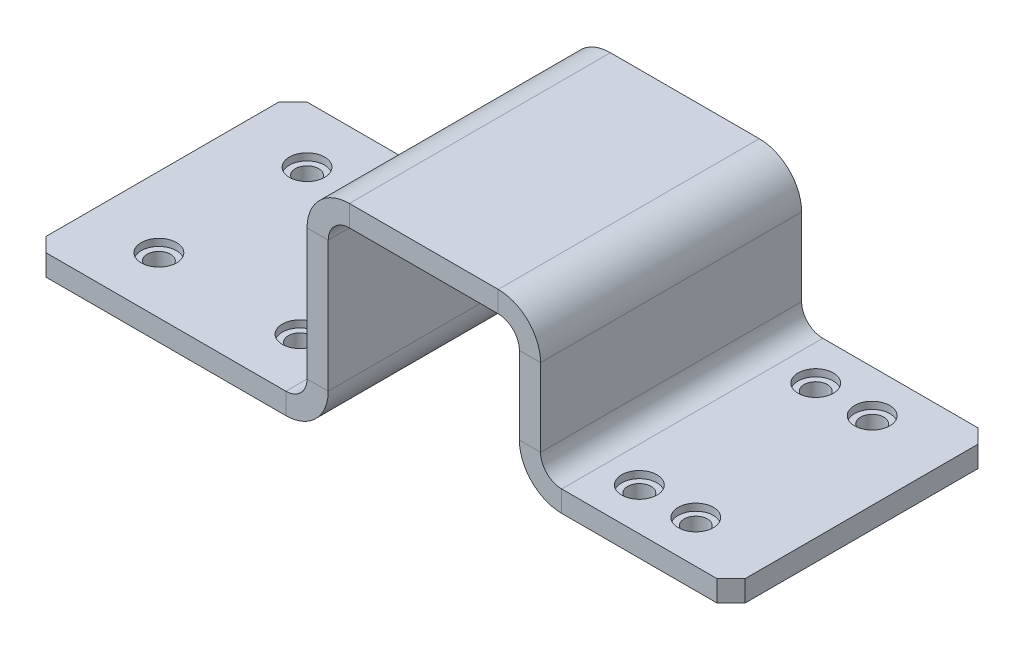
from build123d import *

# Parameters (mm, degrees)
SM_BASE_FLANGE_1_DEPTH    = 37
CHAMFER_1_SIZE            = 2
HOLE_WIZARD_1_D           = 3.3
HOLE_WIZARD_1_DEPTH       = 3
HOLE_WIZARD_1_CBORE_D     = 5
HOLE_WIZARD_1_CBORE_DEPTH = 1
HOLE_WIZARD_1_TIP         = 0.991420021
HOLE_WIZARD_2_D           = 3.3
HOLE_WIZARD_2_DEPTH       = 3
HOLE_WIZARD_2_CBORE_D     = 5
HOLE_WIZARD_2_CBORE_DEPTH = 1
HOLE_WIZARD_2_TIP         = 0.991420021


# Sheet-metal steps are written as plain solids
with BuildPart() as part:
    # Sketch 1 → 基体-法兰1 (new body)
    with BuildSketch(Plane.XY):
        with BuildLine():
            Line((60.1, 7.55), (36.1, 7.55))
            ThreePointArc((36.1, 7.55), (33.978679656, 8.428679656), (33.1, 10.55))
            Line((33.1, 10.55), (33.1, 21.55))
            ThreePointArc((33.1, 21.55), (31.342640687, 25.792640687), (27.1, 27.55))
            Line((27.1, 27.55), (6, 27.55))
            ThreePointArc((6, 27.55), (1.757359313, 25.792640687), (0, 21.55))
            Line((0, 21.55), (0, 3))
            ThreePointArc((0, 3), (-0.878679656, 0.878679656), (-3, 0))
            Line((-3, 0), (-39, 0))
            Line((-39, 0), (-39, -3))
            Line((-39, -3), (-3, -3))
            ThreePointArc((-3, -3), (1.242640687, -1.242640687), (3, 3))
            Line((3, 3), (3, 21.55))
            ThreePointArc((3, 21.55), (3.878679656, 23.671320344), (6, 24.55))
            Line((6, 24.55), (27.1, 24.55))
            ThreePointArc((27.1, 24.55), (29.221320344, 23.671320344), (30.1, 21.55))
            Line((30.1, 21.55), (30.1, 10.55))
            ThreePointArc((30.1, 10.55), (31.857359313, 6.307359313), (36.1, 4.55))
            Line((36.1, 4.55), (60.1, 4.55))
            Line((60.1, 4.55), (60.1, 7.55))
        make_face()
    extrude(amount=SM_BASE_FLANGE_1_DEPTH)

    # 倒角1
    chamfer_1_edges = [part.edges().sort_by_distance(p)[0] for p in [
        (-39, -1.5, 0),
        (60.1, 6.05, 0),
        (-39, -1.5, 37),
        (60.1, 6.05, 37),
    ]]
    chamfer(chamfer_1_edges, length=CHAMFER_1_SIZE)

    # 打孔尺寸(%根据)内六角圆柱头螺钉的类型1
    with Locations(Plane(origin=(0, 7.55, 0), x_dir=(1, 0, 0), z_dir=(0, 1, 0))):
        with Locations((49.1, -6), (49.1, -31), (41.1, -31), (41.1, -6)):
            CounterBoreHole(HOLE_WIZARD_1_D / 2, HOLE_WIZARD_1_CBORE_D / 2, HOLE_WIZARD_1_CBORE_DEPTH, depth=HOLE_WIZARD_1_DEPTH)
            with Locations((0, 0, -(HOLE_WIZARD_1_DEPTH + HOLE_WIZARD_1_TIP / 2))):  # 118° drill point
                Cone(0, HOLE_WIZARD_1_D / 2, HOLE_WIZARD_1_TIP, mode=Mode.SUBTRACT)

    # 打孔尺寸(%根据)内六角圆柱头螺钉的类型2
    with Locations(Plane(origin=(0, 0, 0), x_dir=(1, 0, 0), z_dir=(0, 1, 0))):
        with Locations((-29, -8), (-9, -8), (-9, -29), (-29, -29)):
            CounterBoreHole(HOLE_WIZARD_2_D / 2, HOLE_WIZARD_2_CBORE_D / 2, HOLE_WIZARD_2_CBORE_DEPTH, depth=HOLE_WIZARD_2_DEPTH)
            with Locations((0, 0, -(HOLE_WIZARD_2_DEPTH + HOLE_WIZARD_2_TIP / 2))):  # 118° drill point
                Cone(0, HOLE_WIZARD_2_D / 2, HOLE_WIZARD_2_TIP, mode=Mode.SUBTRACT)


solid = part.part
